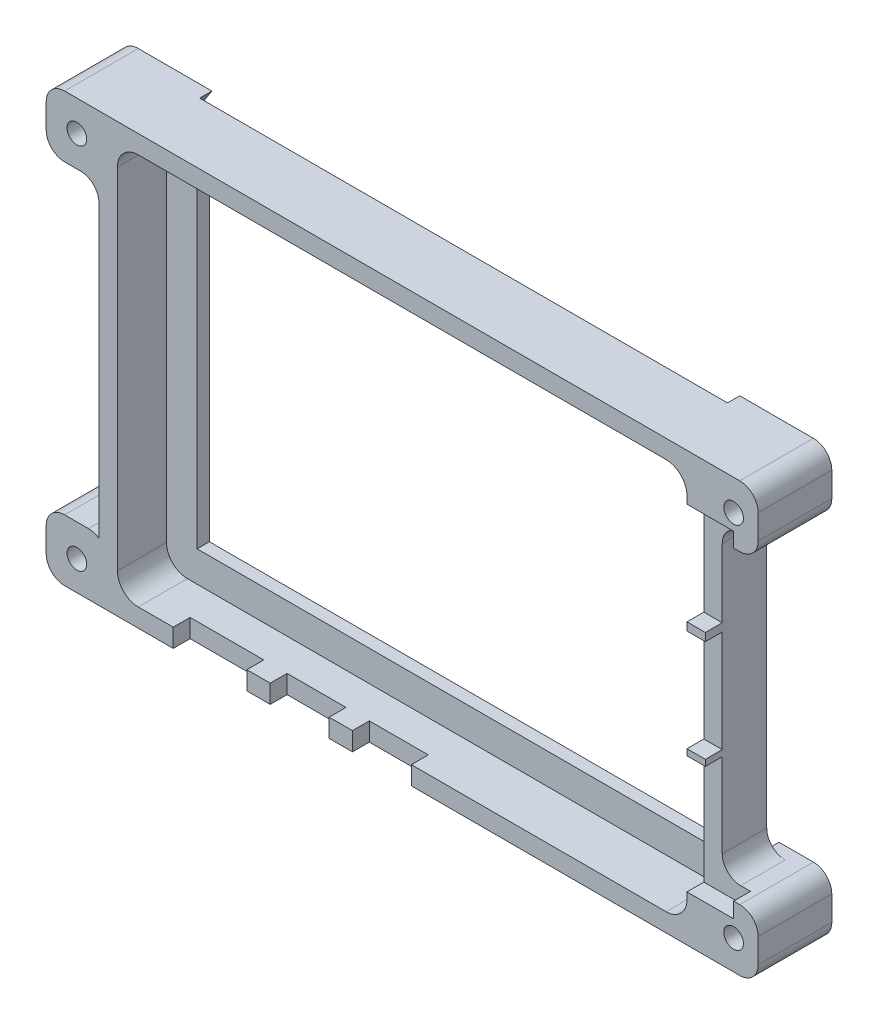
from build123d import *

# Parameters (mm, degrees)
FRAME_HEIGHT_8_DEPTH              = 8
FRAME_HEIGHT_8_DEPTH_BACK         = 2
FRAMEOUTSIDE_W                    = 98.8
FRAMEOUTSIDE_H                    = 69.8
OUTSIDE_R6P4_R                    = 6.4
FRAMEINSIDE_W                     = 92.8
FRAMEINSIDE_H                     = 63.8
OPEN_THROUGH_FRAME_DEPTH          = 8.3
INSIDE_R3P4_R                     = 3.4
INTEGRAL_EARS_4X3P2_DEPTH         = 8
INTEGRAL_EARS_4X3P2_DEPTH_BACK    = 4
FOUR_CORNER_EARS_R2_PITCH110X80_R = 1.6
OPEN_TOP_CABLE_RELIEFS_START      = 5.25
PLUG_CLEARANCE_PROFILES_W         = 12
PLUG_CLEARANCE_PROFILES_H         = 8
PLUG_CLEARANCE_PROFILES_W_2       = 9.6
PLUG_CLEARANCE_PROFILES_W_3       = 8.5
PLUG_CLEARANCE_PROFILES_H_2       = 19.2
PLUG_CLEARANCE_PROFILES_H_3       = 16.6
OPEN_TOP_CABLE_RELIEFS_DEPTH      = 3.25
FILLET_1_R                        = 3
SKETCH_1_W                        = 82.8
SKETCH_1_H                        = 53.8
CUT_EXTRUDE_1_DEPTH               = 10


with BuildPart() as part:
    # FrameOutside → Frame_Height_8 (new, two sides: drawn at the far end of the back side and taken through both)
    with BuildSketch(Plane.XY.offset(-FRAME_HEIGHT_8_DEPTH_BACK)):
        Rectangle(FRAMEOUTSIDE_W, FRAMEOUTSIDE_H)
    extrude(amount=FRAME_HEIGHT_8_DEPTH + FRAME_HEIGHT_8_DEPTH_BACK)

    # Outside_R6p4
    outside_r6p4_edges = [part.edges().sort_by_distance(p)[0] for p in [
        (49.4, 34.9, 3),
        (49.4, -34.9, 3),
        (-49.4, 34.9, 3),
        (-49.4, -34.9, 3),
    ]]
    fillet(outside_r6p4_edges, radius=OUTSIDE_R6P4_R)

    # FrameInside → Open_Through_Frame (cut)
    with BuildSketch(Plane.XY):
        Rectangle(FRAMEINSIDE_W, FRAMEINSIDE_H)
    extrude(amount=OPEN_THROUGH_FRAME_DEPTH, mode=Mode.SUBTRACT)

    # Inside_R3p4
    inside_r3p4_edges = [part.edges().sort_by_distance(p)[0] for p in [
        (46.4, 31.9, 4),
        (46.4, -31.9, 4),
        (-46.4, 31.9, 4),
        (-46.4, -31.9, 4),
    ]]
    fillet(inside_r3p4_edges, radius=INSIDE_R3P4_R)

    # Four_Corner_Ears_R2_Pitch110x80 → Integral_Ears_4x3p2 (add, two sides: drawn at the far end of the back side and taken through both)
    # profile 1 of 4: a face of its own
    with BuildSketch(Plane.XY.offset(-INTEGRAL_EARS_4X3P2_DEPTH_BACK)):
        Polygon((43, 34.9), (58, 34.9), (58, 24.9), (49.4, 24.9), align=None)
        with Locations((54, 29.9)):
            Circle(FOUR_CORNER_EARS_R2_PITCH110X80_R, mode=Mode.SUBTRACT)
    # profile 2 of 4: a face of its own
    with BuildSketch(Plane.XY.offset(-INTEGRAL_EARS_4X3P2_DEPTH_BACK)):
        Polygon((43, -34.9), (58, -34.9), (58, -24.9), (49.4, -24.9), align=None)
        with Locations((54, -30.1)):
            Circle(FOUR_CORNER_EARS_R2_PITCH110X80_R, mode=Mode.SUBTRACT)
    # profile 3 of 4: a face of its own
    with BuildSketch(Plane.XY.offset(-INTEGRAL_EARS_4X3P2_DEPTH_BACK)):
        Polygon((-43, -34.9), (-58, -34.9), (-58, -24.9), (-49.480769769, -24.9), align=None)
        with Locations((-53, -30.1)):
            Circle(FOUR_CORNER_EARS_R2_PITCH110X80_R, mode=Mode.SUBTRACT)
    # profile 4 of 4: a face of its own
    with BuildSketch(Plane.XY.offset(-INTEGRAL_EARS_4X3P2_DEPTH_BACK)):
        Polygon((-43, 34.9), (-58, 34.9), (-58, 24.9), (-49.4, 24.9), align=None)
        with Locations((-53, 29.9)):
            Circle(FOUR_CORNER_EARS_R2_PITCH110X80_R, mode=Mode.SUBTRACT)
    extrude(amount=INTEGRAL_EARS_4X3P2_DEPTH + INTEGRAL_EARS_4X3P2_DEPTH_BACK)

    # Plug_Clearance_Profiles → Open_Top_Cable_Reliefs (cut)
    with BuildSketch(Plane.XY.offset(OPEN_TOP_CABLE_RELIEFS_START)):
        with Locations((-31.3, -35)):
            Rectangle(PLUG_CLEARANCE_PROFILES_W, PLUG_CLEARANCE_PROFILES_H)
        with Locations((-16.7, -35)):
            Rectangle(PLUG_CLEARANCE_PROFILES_W_2, PLUG_CLEARANCE_PROFILES_H)
        with Locations((-3.3, -35)):
            Rectangle(PLUG_CLEARANCE_PROFILES_W_2, PLUG_CLEARANCE_PROFILES_H)
        with Locations((49.75, -17.8)):
            Rectangle(PLUG_CLEARANCE_PROFILES_W_3, PLUG_CLEARANCE_PROFILES_H_2)
        with Locations((49.75, 1.1)):
            Rectangle(PLUG_CLEARANCE_PROFILES_W_3, PLUG_CLEARANCE_PROFILES_H_3)
        with Locations((49.75, 19)):
            Rectangle(PLUG_CLEARANCE_PROFILES_W_3, PLUG_CLEARANCE_PROFILES_H_3)
    extrude(amount=OPEN_TOP_CABLE_RELIEFS_DEPTH, mode=Mode.SUBTRACT)

    # 圆角1
    fillet_1_edges = [part.edges().sort_by_distance(p)[0] for p in [
        (-49.4, 24.9, 3),
        (49.4, -24.9, 1.625),
        (49.4, 24.9, 1.625),
    ]]
    fillet(fillet_1_edges, radius=FILLET_1_R)
    fillet_1_2_edges = [part.edges().sort_by_distance(p)[0] for p in [
        (-58, 34.9, 2),
        (-58, 24.9, 2),
        (-49.480769769, -24.9, 2),
        (-58, -24.9, 2),
        (-58, -34.9, 2),
        (58, -24.9, 2),
        (58, -34.9, 2),
        (58, 24.9, 2),
        (58, 34.9, 2),
    ]]
    fillet(fillet_1_2_edges, radius=FILLET_1_R)

    # 草图1 → 切除-拉伸1 (cut)
    with BuildSketch(Plane.XY):
        Rectangle(SKETCH_1_W, SKETCH_1_H)
    extrude(amount=-CUT_EXTRUDE_1_DEPTH, mode=Mode.SUBTRACT)


solid = part.part
